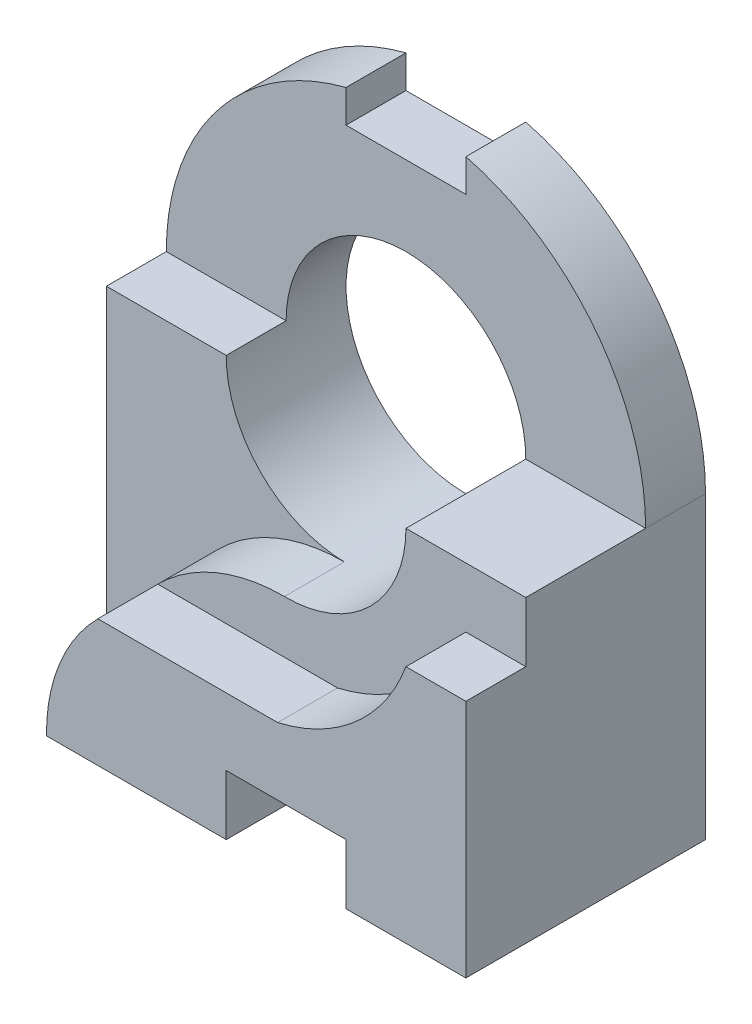
from build123d import *

# Parameters (mm, degrees)
SKETCH1_R           = 2
BOSS_EXTRUDE1_DEPTH = 4
SKETCH2_W           = 2
SKETCH2_H           = 1
CUT_EXTRUDE1_DEPTH  = 4
CUT_EXTRUDE2_START  = -4
CUT_EXTRUDE2_DEPTH  = 4
CUT_EXTRUDE3_START  = -3
CUT_EXTRUDE3_DEPTH  = 3
CUT_EXTRUDE4_START  = -2
CUT_EXTRUDE4_DEPTH  = 2
CUT_EXTRUDE5_START  = -1
CUT_EXTRUDE5_DEPTH  = 1


# Read off the part's stored shape, not the designer's step: Cut-Extrude4
with BuildPart() as part:
    # Sketch1 → Boss-Extrude1 (new body)
    with BuildSketch(Plane.XY):
        with BuildLine():
            Line((4, -5), (-4, -5))
            Line((-4, -5), (-4, 0))
            ThreePointArc((-4, 0), (0, 4), (4, 0))
            Line((4, 0), (4, -5))
        make_face()
        Circle(SKETCH1_R, mode=Mode.SUBTRACT)
    extrude(amount=BOSS_EXTRUDE1_DEPTH)

    # Sketch2 → Cut-Extrude1 (cut)
    with BuildSketch(Plane.XY.offset(4)):
        with Locations((1, -4.5)):
            Rectangle(SKETCH2_W, SKETCH2_H)
    extrude(amount=-CUT_EXTRUDE1_DEPTH, mode=Mode.SUBTRACT)

    # Sketch3 → Cut-Extrude2 (cut)
    with BuildSketch(Plane.XY.offset(4).offset(CUT_EXTRUDE2_START)):
        with BuildLine():
            Line((1, 3.327826432), (-1, 3.327826432))
            Line((-1, 3.327826432), (-1, 3.872983346))
            ThreePointArc((-1, 3.872983346), (0, 4), (1, 3.872983346))
            Line((1, 3.872983346), (1, 3.327826432))
        make_face()
    extrude(amount=CUT_EXTRUDE2_DEPTH, mode=Mode.SUBTRACT)

    # Sketch5 → Cut-Extrude3 (cut)
    with BuildSketch(Plane.XY.offset(4).offset(CUT_EXTRUDE3_START)):
        with BuildLine():
            Line((4, 0), (-4, 0))
            ThreePointArc((-4, 0), (0, 4), (4, 0))
        make_face()
    extrude(amount=CUT_EXTRUDE3_DEPTH, mode=Mode.SUBTRACT)

    # Cut-Extrude4 outline → Cut-Extrude4 (cut)
    with BuildSketch(Plane.XY.offset(4).offset(CUT_EXTRUDE4_START)):
        with BuildLine():
            ThreePointArc((-3, -5), (-2.142135206, -2.878264494), (-0.028848782, -1.999791926))
            ThreePointArc((-0.028848782, -1.999791926), (-1.424376629, -1.403976929), (-2, 0))
            Line((-2, 0), (-4, 0))
            Line((-4, 0), (-4, -5))
            Line((-4, -5), (-3, -5))
        make_face()
    extrude(amount=CUT_EXTRUDE4_DEPTH, mode=Mode.SUBTRACT)

    # Sketch7 → Cut-Extrude5 (cut)
    with BuildSketch(Plane.XY.offset(4).offset(CUT_EXTRUDE5_START)):
        with BuildLine():
            Line((3, -1), (4, -1))
            Line((4, -1), (4, 0))
            Line((4, 0), (2, 0))
            ThreePointArc((2, 0), (1.403976929, -1.424376629), (-0.028848782, -1.999791926))
            ThreePointArc((-0.028848782, -1.999791926), (-1.173685148, -2.226867466), (-2.142135206, -2.878264494))
            Line((-2.142135206, -2.878264494), (0.857864794, -2.878264494))
            ThreePointArc((0.857864794, -2.878264494), (2.166117347, -2.209638468), (3, -1))
        make_face()
    extrude(amount=CUT_EXTRUDE5_DEPTH, mode=Mode.SUBTRACT)


solid = part.part
